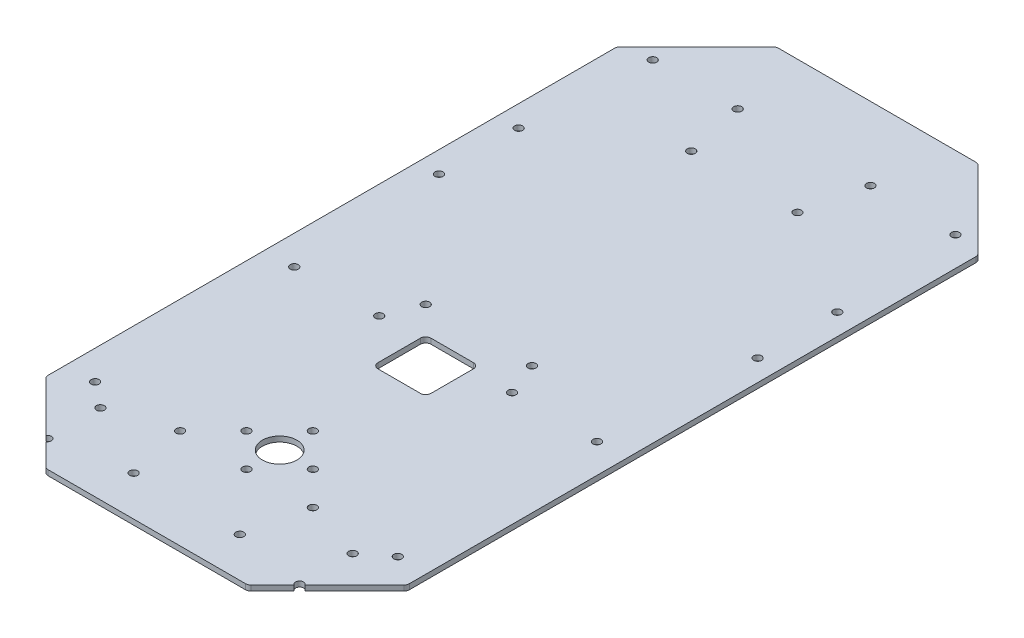
from build123d import *

# Parameters (mm, degrees)
SKETCH_1_W                  = 136
SKETCH_1_H                  = 275
EXTRUDE_856_DEPTH           = 2
SKETCH_12_R                 = 1.5
CUT_EXTRUDE_1346_DEPTH      = 161.165539365
SKETCH_5_R                  = 1.5
RASPBERRY_DEPTH             = 161.165539365
CUT_EXTRUDE_2206_DEPTH      = 161.165539365
CUT_EXTRUDE_2206_DEPTH_BACK = 161.165539365
SKETCH_8_R                  = 1.5
SKETCH_11_W                 = 20
SKETCH_11_H                 = 20
CUT_EXTRUDE_2706_DEPTH      = 161.165539365
SKETCH_13_R                 = 1.5
CUT_EXTRUDE_3307_DEPTH      = 161.165539365
SKETCH_9_R                  = 6.5
SKETCH_9_R_2                = 1.5
CUT_EXTRUDE_4023_DEPTH      = 161.165539365
FILLET_3_R                  = 2
CHAMFER_1_SIZE              = 30
SKETCH_14_R                 = 1.5
CUT_EXTRUDE_4981_DEPTH      = 161.165539365
FILLET_4_R                  = 2


with BuildPart() as part:
    # Эскиз1 → Extrude 856 (new body)
    with BuildSketch(Plane(origin=(0, 0, 0), x_dir=(1, 0, 0), z_dir=(0, 1, 0))):
        with Locations((0, -7.5)):
            Rectangle(SKETCH_1_W, SKETCH_1_H)
    extrude(amount=EXTRUDE_856_DEPTH)

    # Эскиз12 → Cut-Extrude 1346 (cut, through all)
    with BuildSketch(Plane(origin=(0, 2, 0), x_dir=(1, 0, 0), z_dir=(0, 1, 0))):
        with Locations((60, 55)):
            Circle(SKETCH_12_R)
        with Locations((-60, 55)):
            Circle(SKETCH_12_R)
        with Locations((-60, 25)):
            Circle(SKETCH_12_R)
        with Locations((60, 25)):
            Circle(SKETCH_12_R)
    extrude(amount=-CUT_EXTRUDE_1346_DEPTH, mode=Mode.SUBTRACT)

    # Эскиз5 → raspberry (cut, through all)
    with BuildSketch(Plane(origin=(0, 2, 0), x_dir=(1, 0, 0), z_dir=(0, 1, 0))):
        with Locations((-20, 80)):
            Circle(SKETCH_5_R)
        with Locations((20, 80)):
            Circle(SKETCH_5_R)
        with Locations((20, -20)):
            Circle(SKETCH_5_R)
        with Locations((-20, -20)):
            Circle(SKETCH_5_R)
    extrude(amount=-RASPBERRY_DEPTH, mode=Mode.SUBTRACT)

    # Эскиз8 → Cut-Extrude 2206 (cut, two sides: drawn at the far end of the back side and taken through both)
    with BuildSketch(Plane(origin=(0, 2, 0), x_dir=(1, 0, 0), z_dir=(0, 1, 0)).offset(-CUT_EXTRUDE_2206_DEPTH_BACK)):
        with Locations((-20, -130)):
            Circle(SKETCH_8_R)
        with Locations((20, -130)):
            Circle(SKETCH_8_R)
    extrude(amount=CUT_EXTRUDE_2206_DEPTH + CUT_EXTRUDE_2206_DEPTH_BACK, mode=Mode.SUBTRACT)

    # Эскиз11 → Cut-Extrude 2706 (cut, through all)
    with BuildSketch(Plane(origin=(0, 2, 0), x_dir=(1, 0, 0), z_dir=(0, 1, 0))):
        with Locations((0, -40)):
            Rectangle(SKETCH_11_W, SKETCH_11_H)
    extrude(amount=-CUT_EXTRUDE_2706_DEPTH, mode=Mode.SUBTRACT)

    # Эскиз13 → Cut-Extrude 3307 (cut, through all)
    with BuildSketch(Plane(origin=(0, 2, 0), x_dir=(1, 0, 0), z_dir=(0, 1, 0))):
        with Locations((-57, 102.5)):
            Circle(SKETCH_13_R)
        with Locations((57, 102.5)):
            Circle(SKETCH_13_R)
        with Locations((57, -32.5)):
            Circle(SKETCH_13_R)
        with Locations((-57, -32.5)):
            Circle(SKETCH_13_R)
        with Locations((-57, -107.5)):
            Circle(SKETCH_13_R)
        with Locations((57, -107.5)):
            Circle(SKETCH_13_R)
        with Locations((-25, 102.5)):
            Circle(SKETCH_13_R)
        with Locations((25, 102.5)):
            Circle(SKETCH_13_R)
        with Locations((25, -32.5)):
            Circle(SKETCH_13_R)
        with Locations((-25, -32.5)):
            Circle(SKETCH_13_R)
        with Locations((-25, -107.5)):
            Circle(SKETCH_13_R)
        with Locations((25, -107.5)):
            Circle(SKETCH_13_R)
    extrude(amount=-CUT_EXTRUDE_3307_DEPTH, mode=Mode.SUBTRACT)

    # Эскиз9 → Cut-Extrude 4023 (cut, through all)
    with BuildSketch(Plane(origin=(0, 2, 0), x_dir=(1, 0, 0), z_dir=(0, 1, 0))):
        with Locations((0, -95)):
            Circle(SKETCH_9_R)
        with Locations((0, -82.5)):
            Circle(SKETCH_9_R_2)
        with Locations((12.5, -95)):
            Circle(SKETCH_9_R_2)
        with Locations((-12.5, -95)):
            Circle(SKETCH_9_R_2)
        with Locations((0, -107.5)):
            Circle(SKETCH_9_R_2)
    extrude(amount=-CUT_EXTRUDE_4023_DEPTH, mode=Mode.SUBTRACT)

    # Скругление3
    fillet_3_edges = [part.edges().sort_by_distance(p)[0] for p in [
        (-10, 1, 50),
        (10, 1, 50),
        (10, 1, 30),
        (-10, 1, 30),
    ]]
    fillet(fillet_3_edges, radius=FILLET_3_R)

    # Фаска1
    chamfer_1_edges = [part.edges().sort_by_distance(p)[0] for p in [
        (-68, 1, 145),
        (68, 1, 145),
        (68, 1, -130),
        (-68, 1, -130),
    ]]
    chamfer(chamfer_1_edges, length=CHAMFER_1_SIZE)

    # Эскиз14 → Cut-Extrude 4981 (cut, through all)
    with BuildSketch(Plane(origin=(0, 2, 0), x_dir=(1, 0, 0), z_dir=(0, 1, 0))):
        with Locations((-47.5, -115)):
            Circle(SKETCH_14_R)
        with Locations((-47.5, -135)):
            Circle(SKETCH_14_R)
        with Locations((47.5, -115)):
            Circle(SKETCH_14_R)
        with Locations((47.5, -135)):
            Circle(SKETCH_14_R)
    extrude(amount=-CUT_EXTRUDE_4981_DEPTH, mode=Mode.SUBTRACT)

    # Скругление4
    fillet_4_edges = [part.edges().sort_by_distance(p)[0] for p in [
        (-68, 1, -100),
        (-38, 1, -130),
        (38, 1, -130),
        (68, 1, -100),
        (68, 1, 115),
        (38, 1, 145),
        (-68, 1, 115),
        (-38, 1, 145),
    ]]
    fillet(fillet_4_edges, radius=FILLET_4_R)


solid = part.part
